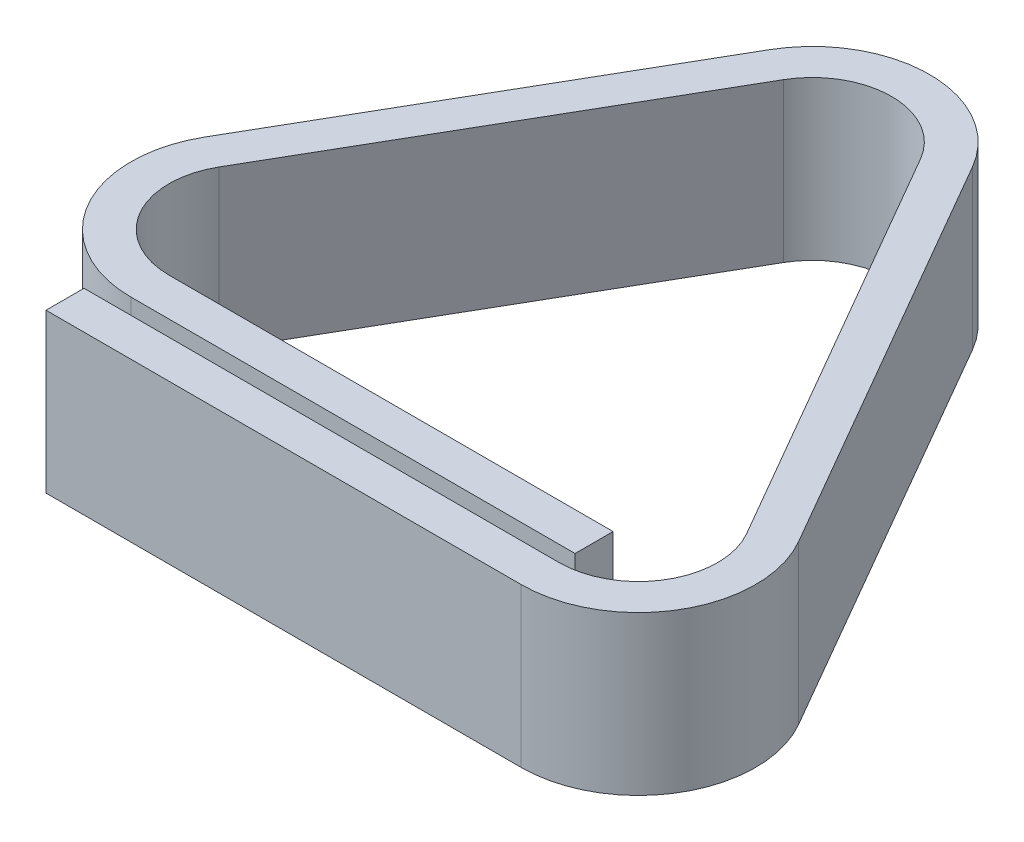
from build123d import *

# Parameters (mm, degrees)
BOSS_EXTRU_1_DEPTH = 10


with BuildPart() as part:
    # Esquisse1 → Boss.-Extru.1 (new body)
    with BuildSketch(Plane(origin=(0, 0, 0), x_dir=(1, 0, 0), z_dir=(0, 1, 0))):
        with BuildLine():
            Line((0, 0), (30, 0))
            ThreePointArc((30, 0), (34.330127019, 2.5), (34.330127019, 7.5))
            Line((34.330127019, 7.5), (19.330127019, 33.480762114))
            ThreePointArc((19.330127019, 33.480762114), (15, 35.980762114), (10.669872981, 33.480762114))
            Line((10.669872981, 33.480762114), (-2.367136104, 10.9))
            ThreePointArc((-2.367136104, 10.9), (-2.367136104, 5.9), (1.962990915, 3.4))
            Line((1.962990915, 3.4), (30, 3.4))
            Line((30, 3.4), (30, 1))
            Line((30, 1), (1.962990915, 1))
            ThreePointArc((1.962990915, 1), (-4.445597073, 4.7), (-4.445597073, 12.1))
            Line((-4.445597073, 12.1), (8.591412012, 34.680762114))
            ThreePointArc((8.591412012, 34.680762114), (15, 38.380762114), (21.408587988, 34.680762114))
            Line((21.408587988, 34.680762114), (36.408587988, 8.7))
            ThreePointArc((36.408587988, 8.7), (36.408587988, 1.3), (30, -2.4))
            Line((30, -2.4), (0, -2.4))
            Line((0, -2.4), (0, 0))
        make_face()
    extrude(amount=BOSS_EXTRU_1_DEPTH)


solid = part.part
